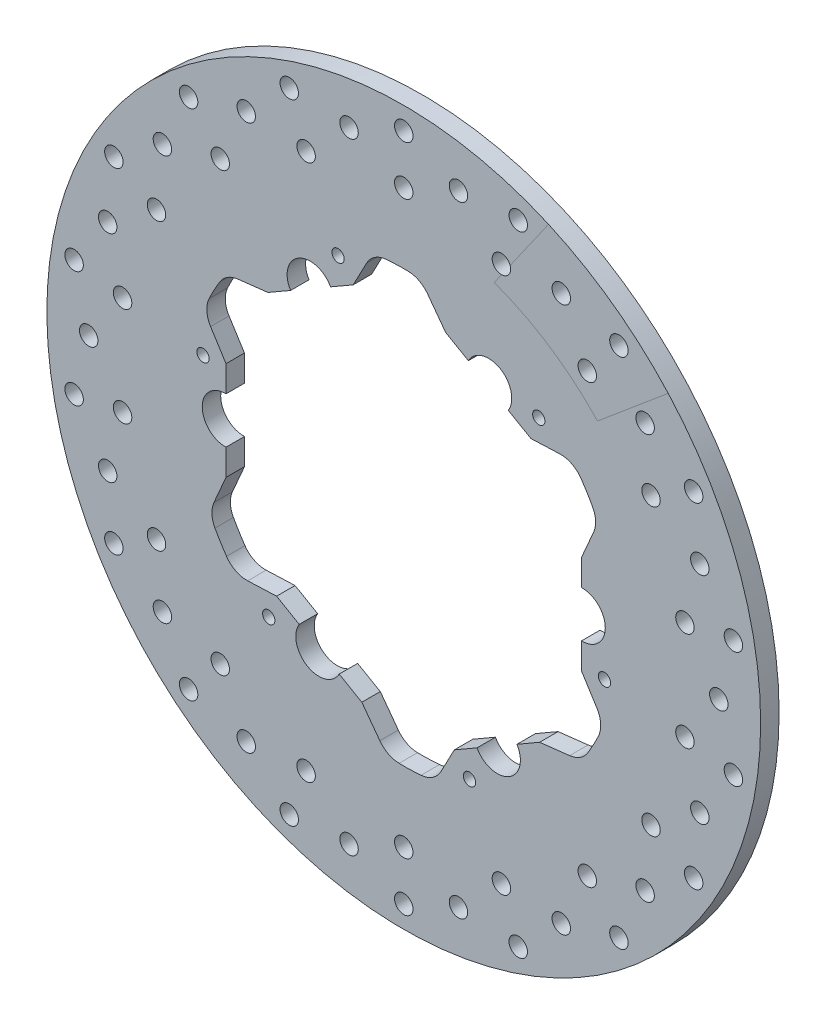
from build123d import *

# Parameters (mm, degrees)
SKETCH1_R             = 92.075
BOSS_EXTRUDE1_DEPTH   = 4.7625
FILLET1_R             = 6.35
SKETCH4_R             = 1.5875
CUT_EXTRUDE1_DEPTH    = 131.30077765
SKETCH5_R             = 2.38125
CUT_EXTRUDE2_DEPTH    = 131.30077765
FRONTPATERNCOPY_COUNT = 18


with BuildPart() as part:
    # Sketch1 → Boss-Extrude1 (new body)
    with BuildSketch(Plane.XY):
        Circle(SKETCH1_R)
        with BuildLine():
            Line((-45.8597, 4.659861673), (-45.8597, 11.409392412))
            Line((-45.8597, 11.409392412), (-51.623596361, 20.547401417))
            ThreePointArc((-51.623596361, 20.547401417), (-49.007713262, 26.180822124), (-45.779418198, 31.487081093))
            Line((-45.779418198, 31.487081093), (-35.046071586, 32.720361416))
            Line((-35.046071586, 32.720361416), (-29.200806502, 36.095126785))
            ThreePointArc((-29.200806502, 36.095126785), (-27.113011458, 44.379898214), (-18.894291413, 42.045596046))
            Line((-18.894291413, 42.045596046), (-13.04902633, 45.420361416))
            Line((-13.04902633, 45.420361416), (-8.017226572, 54.981046592))
            ThreePointArc((-8.017226572, 54.981046592), (-1.830599579, 55.532335728), (4.378903018, 55.389679676))
            Line((4.378903018, 55.389679676), (10.813628414, 46.710969004))
            Line((10.813628414, 46.710969004), (16.658893498, 43.336203635))
            ThreePointArc((16.658893498, 43.336203635), (24.877613542, 45.670505803), (26.965408587, 37.385734374))
            Line((26.965408587, 37.385734374), (32.81067367, 34.010969004))
            Line((32.81067367, 34.010969004), (43.606369789, 34.433645175))
            ThreePointArc((43.606369789, 34.433645175), (47.177113682, 29.351513604), (50.158321216, 23.902598583))
            Line((50.158321216, 23.902598583), (45.8597, 13.990607588))
            Line((45.8597, 13.990607588), (45.8597, 7.241076849))
            ThreePointArc((45.8597, 7.241076849), (51.990625, 1.290607588), (45.8597, -4.659861673))
            Line((45.8597, -4.659861673), (45.8597, -11.409392412))
            Line((45.8597, -11.409392412), (51.623596361, -20.547401417))
            ThreePointArc((51.623596361, -20.547401417), (49.007713262, -26.180822124), (45.779418198, -31.487081093))
            Line((45.779418198, -31.487081093), (35.046071586, -32.720361416))
            Line((35.046071586, -32.720361416), (29.200806502, -36.095126785))
            ThreePointArc((29.200806502, -36.095126785), (27.113011458, -44.379898214), (18.894291413, -42.045596046))
            Line((18.894291413, -42.045596046), (13.04902633, -45.420361416))
            Line((13.04902633, -45.420361416), (8.017226572, -54.981046592))
            ThreePointArc((8.017226572, -54.981046592), (1.830599579, -55.532335728), (-4.378903018, -55.389679676))
            Line((-4.378903018, -55.389679676), (-10.813628414, -46.710969004))
            Line((-10.813628414, -46.710969004), (-16.658893498, -43.336203635))
            ThreePointArc((-16.658893498, -43.336203635), (-24.877613542, -45.670505803), (-26.965408587, -37.385734374))
            Line((-26.965408587, -37.385734374), (-32.81067367, -34.010969004))
            Line((-32.81067367, -34.010969004), (-43.606369789, -34.433645175))
            ThreePointArc((-43.606369789, -34.433645175), (-47.177113682, -29.351513604), (-50.158321216, -23.902598583))
            Line((-50.158321216, -23.902598583), (-45.8597, -13.990607588))
            Line((-45.8597, -13.990607588), (-45.8597, -7.241076849))
            ThreePointArc((-45.8597, -7.241076849), (-51.990625, -1.290607588), (-45.8597, 4.659861673))
        make_face(mode=Mode.SUBTRACT)
    extrude(amount=BOSS_EXTRUDE1_DEPTH)

    # Fillet1
    fillet1_edges = [part.edges().sort_by_distance(p)[0] for p in [
        (8.017226572, -54.981046592, 2.38125),
        (45.779418198, -31.487081093, 2.38125),
        (-4.378903018, -55.389679676, 2.38125),
        (-43.606369789, -34.433645175, 2.38125),
        (51.623596361, -20.547401417, 2.38125),
        (50.158321216, 23.902598583, 2.38125),
        (43.606369789, 34.433645175, 2.38125),
        (4.378903018, 55.389679676, 2.38125),
        (-50.158321216, -23.902598583, 2.38125),
        (-51.623596361, 20.547401417, 2.38125),
        (-8.017226572, 54.981046592, 2.38125),
        (-45.779418198, 31.487081093, 2.38125),
    ]]
    fillet(fillet1_edges, radius=FILLET1_R)

    # Sketch4 → Cut-Extrude1 (cut, through all)
    with BuildSketch(Plane.XY.offset(4.7625)):
        with Locations((-16.953011458, 50.011322779)):
            Circle(SKETCH4_R)
        with Locations((34.834570274, 39.687399983)):
            Circle(SKETCH4_R)
        with Locations((51.787581732, -10.323922796)):
            Circle(SKETCH4_R)
        with Locations((16.953011458, -50.011322779)):
            Circle(SKETCH4_R)
        with Locations((-34.834570274, -39.687399983)):
            Circle(SKETCH4_R)
        with Locations((-51.787581732, 10.323922796)):
            Circle(SKETCH4_R)
    extrude(amount=-CUT_EXTRUDE1_DEPTH, mode=Mode.SUBTRACT)

    # Sketch5 → Cut-Extrude2 (cut, through all)
    with BuildSketch(Plane.XY.offset(4.7625)):
        with Locations((0, 86.36)):
            Circle(SKETCH5_R)
        with Locations((0, 73.66)):
            Circle(SKETCH5_R)
        with Locations((14.114123881, 80.045174165)):
            Circle(SKETCH5_R)
    cut_extrude2 = extrude(amount=-CUT_EXTRUDE2_DEPTH, mode=Mode.SUBTRACT)

    # FrontPaternCopy: Cut-Extrude2 ×18 about axis
    frontpaterncopy_axis = Axis((0, 0, 4.7625), (0, 0, 1))
    for i in range(1, FRONTPATERNCOPY_COUNT):
        add(cut_extrude2.rotate(frontpaterncopy_axis, i * 360 / FRONTPATERNCOPY_COUNT), mode=Mode.SUBTRACT)


solid = part.part
